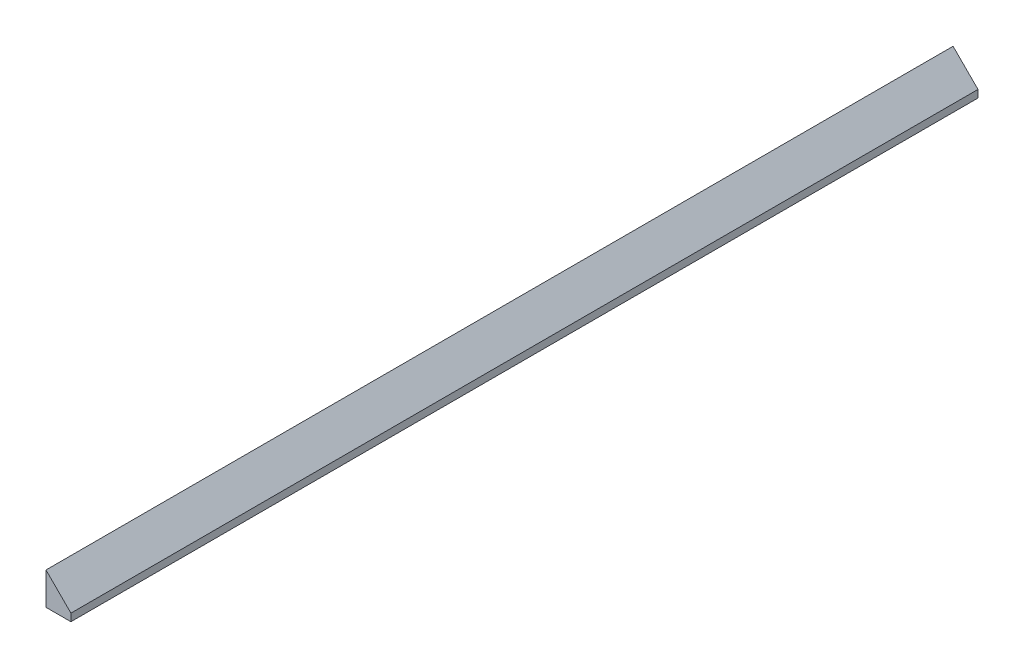
from build123d import *

# Parameters (mm, degrees)
BOSS_EXTRUDE1_DEPTH = 36.4


with BuildPart() as part:
    # Sketch1 → Boss-Extrude1 (new, symmetric)
    with BuildSketch(Plane.XY):
        Polygon((0, 2.6), (0, 0), (2, 0), (2, 0.6), align=None)
    extrude(amount=BOSS_EXTRUDE1_DEPTH, both=True)


solid = part.part
